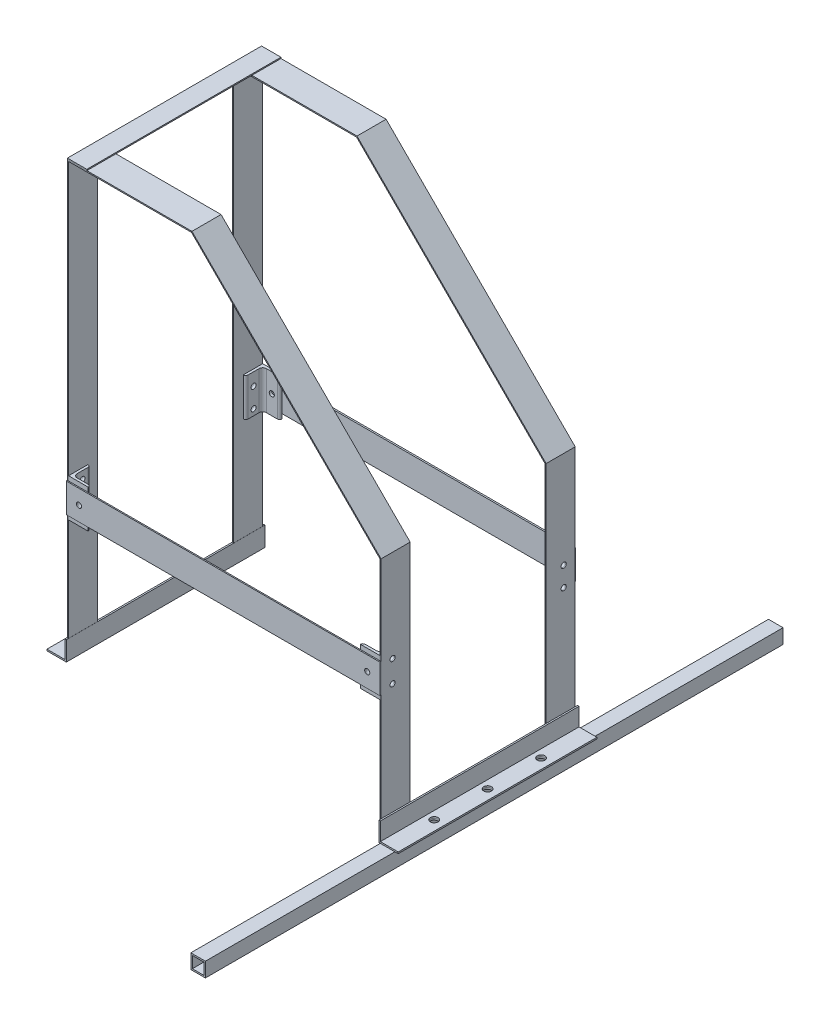
from build123d import *

# Parameters (mm, degrees)
CROQUIS1_W                                  = 19.05
CROQUIS1_H                                  = 19.05
CROQUIS1_W_2                                = 15.05
CROQUIS1_H_2                                = 15.05
SALIENTE_EXTRUIR1_DEPTH                     = 378
SALIENTE_EXTRUIR1_2_DEPTH                   = 378
SALIENTE_EXTRUIR2_DEPTH                     = 130
SALIENTE_EXTRUIR2_2_DEPTH                   = 130
SALIENTE_EXTRUIR3_DEPTH                     = 19.05
MATRIZL1_COUNT                              = 2
MATRIZL1_PITCH                              = 216
CROQUIS5_W                                  = 25.4
CROQUIS5_H                                  = 254.1
SALIENTE_EXTRUIR4_DEPTH                     = 1.5
L_START                                     = 178.739339828
L_ANGLE_L1X1X0_125_1_DEPTH                  = 50
SKETCH12_W                                  = 19.05
SKETCH12_H                                  = 19.05
SKETCH12_W_2                                = 14.8336
SKETCH12_H_2                                = 14.8336
AL_TUBE_SQUARE_0_75_SQ_X_083_WALL_1_DEPTH   = 376.329242488
SKETCH12_ON_SEGMENT_2_W                     = 19.05
SKETCH12_ON_SEGMENT_2_H                     = 19.05
SKETCH12_ON_SEGMENT_2_W_2                   = 14.8336
SKETCH12_ON_SEGMENT_2_H_2                   = 14.8336
AL_TUBE_SQUARE_0_75_SQ_X_083_WALL_1_2_DEPTH = 379.364155734
CROQUIS6_W                                  = 410.487373415
CROQUIS6_H                                  = 38.1
SALIENTE_EXTRUIR5_DEPTH                     = 1.5
CROQUIS14_W                                 = 5.0419
CROQUIS14_H                                 = 21.05
TALADRO_DE_MARGEN_PARA_3_82_AT_2_COUNT      = 2
TALADRO_DE_MARGEN_PARA_3_82_AT_2_PITCH      = 70
TALADRO_DE_MARGEN_PARA_3_82_AT_3_COUNT      = 2
TALADRO_DE_MARGEN_PARA_3_82_AT_3_PITCH      = 140
TALADRO_DE_MARGEN_PARA_3_82_AT_4_COUNT      = 2
TALADRO_DE_MARGEN_PARA_3_82_AT_4_PITCH      = 434.085023559
TALADRO_DE_MARGEN_PARA_3_82_AT_5_COUNT      = 2
TALADRO_DE_MARGEN_PARA_3_82_AT_5_PITCH      = 439.692856069
TALADRO_DE_MARGEN_PARA_3_82_AT_6_COUNT      = 2
TALADRO_DE_MARGEN_PARA_3_82_AT_6_PITCH      = 456.102847698
CROQUIS15_W                                 = 703.878801561
CROQUIS15_H                                 = 245.921773267
CORTAR_EXTRUIR1_DEPTH                       = 757.364155734
CROQUIS16_W                                 = 407.487373415
CROQUIS16_H                                 = 38.1
SALIENTE_EXTRUIR6_DEPTH                     = 2
CROQUIS12_W                                 = 3.3782
CROQUIS12_H                                 = 28.487626585
CROQUIS12_AT_POINT_2_W                      = 3.3782
CROQUIS12_AT_POINT_2_H                      = 28.487626585
CROQUIS12_AT_POINT_3_W                      = 3.3782
CROQUIS12_AT_POINT_3_H                      = 28.487626585
CROQUIS12_AT_POINT_4_W                      = 3.3782
CROQUIS12_AT_POINT_4_H                      = 28.487626585
CROQUIS12_AT_POINT_5_W                      = 3.3782
CROQUIS12_AT_POINT_5_H                      = 28.487626585
CROQUIS12_AT_POINT_6_W                      = 3.3782
CROQUIS12_AT_POINT_6_H                      = 28.487626585
CROQUIS12_AT_POINT_7_W                      = 3.3782
CROQUIS12_AT_POINT_7_H                      = 28.487626585
CROQUIS12_AT_POINT_8_W                      = 3.3782
CROQUIS12_AT_POINT_8_H                      = 28.487626585
CROQUIS12_AT_POINT_9_W                      = 3.3782
CROQUIS12_AT_POINT_9_H                      = 28.487626585
CROQUIS12_AT_POINT_10_W                     = 3.3782
CROQUIS12_AT_POINT_10_H                     = 28.487626585
CROQUIS12_AT_POINT_11_W                     = 3.3782
CROQUIS12_AT_POINT_11_H                     = 28.487626585
CROQUIS12_AT_POINT_12_W                     = 3.3782
CROQUIS12_AT_POINT_12_H                     = 28.487626585


# Read off the part's stored shape, not the designer's step: L angle L1X1X0.125(1)
with BuildPart() as part:
    # Croquis1 → Saliente-Extruir1 (new, symmetric)
    with BuildSketch(Plane.XY):
        with Locations((9.525, 9.525)):
            Rectangle(CROQUIS1_W, CROQUIS1_H)
        with Locations((9.525, 9.525)):
            Rectangle(CROQUIS1_W_2, CROQUIS1_H_2, mode=Mode.SUBTRACT)
    extrude(amount=SALIENTE_EXTRUIR1_DEPTH, both=True)


with BuildPart() as body_2:
    # Croquis1 → Saliente-Extruir1 2 (new, symmetric)
    with BuildSketch(Plane.XY):
        with Locations((224.475, 9.525)):
            Rectangle(CROQUIS1_W, CROQUIS1_H)
        with Locations((224.475, 9.525)):
            Rectangle(CROQUIS1_W_2, CROQUIS1_H_2, mode=Mode.SUBTRACT)
    extrude(amount=SALIENTE_EXTRUIR1_2_DEPTH, both=True)


with BuildPart() as body_3:
    # Croquis2 → Saliente-Extruir2 (new, symmetric)
    with BuildSketch(Plane.XY):
        Polygon((214.95, 44.45), (212.95, 44.45), (212.95, 19.05), (238.35, 19.05), (238.35, 21.05), (214.95, 21.05), align=None)
    extrude(amount=SALIENTE_EXTRUIR2_DEPTH, both=True)


with BuildPart() as body_4:
    # Croquis2 → Saliente-Extruir2 2 (new, symmetric)
    with BuildSketch(Plane.XY):
        Polygon((-197.95, 21.05), (-221.35, 21.05), (-221.35, 19.05), (-195.95, 19.05), (-195.95, 44.45), (-197.95, 44.45), align=None)
    extrude(amount=SALIENTE_EXTRUIR2_2_DEPTH, both=True)


with BuildPart() as body_5:
    # Croquis4 → Saliente-Extruir3 (new, symmetric)
    with BuildSketch(Plane.XY.offset(108)):
        Polygon((212.95, 19.05), (212.95, 339.05), (-34.537373415, 586.537373415), (-197.537373415, 586.537373415), (-197.537373415, 19.05), (-196.037373415, 19.05), (-196.037373415, 585.037373415), (-35.158693759, 585.037373415), (211.45, 338.428679656), (211.45, 19.05), align=None)
    saliente_extruir3 = extrude(amount=SALIENTE_EXTRUIR3_DEPTH, both=True)


with BuildPart() as matrizl1_1:
    # MatrizL1: Saliente-Extruir3 ×2
    with Locations(*[(0, 0, -i * MATRIZL1_PITCH) for i in range(1, MATRIZL1_COUNT)]):
        add(saliente_extruir3)


with BuildPart() as body_7:
    # Croquis5 → Saliente-Extruir4 (new body)
    with BuildSketch(Plane(origin=(0, 586.537373415, 0), x_dir=(1, 0, 0), z_dir=(0, 1, 0))):
        with Locations((-184.837373415, 0)):
            Rectangle(CROQUIS5_W, CROQUIS5_H)
    extrude(amount=SALIENTE_EXTRUIR4_DEPTH)


with BuildPart() as body_8:
    # L angle L1X1X0.125(1) outline → L angle L1X1X0.125(1) (new body)
    with BuildSketch(Plane(origin=(0, 0, 0), x_dir=(1, 0, 0), z_dir=(0, 1, 0)).offset(L_START)):
        with BuildLine():
            Line((186.05, -127.05), (211.45, -127.05))
            Line((211.45, -127.05), (211.45, -101.65))
            Line((211.45, -101.65), (211.44492, -101.65))
            ThreePointArc((211.44492, -101.65), (209.203448072, -102.578448072), (208.275, -104.81992))
            Line((208.275, -104.81992), (208.275, -119.1125))
            ThreePointArc((208.275, -119.1125), (206.880096045, -122.480096045), (203.5125, -123.875))
            Line((203.5125, -123.875), (189.21992, -123.875))
            ThreePointArc((189.21992, -123.875), (186.978448072, -124.803448072), (186.05, -127.04492))
            Line((186.05, -127.04492), (186.05, -127.05))
        make_face()
        with BuildLine():
            Line((-196.037373415, -127.05), (-170.637373415, -127.05))
            Line((-170.637373415, -127.05), (-170.637373415, -127.04492))
            ThreePointArc((-170.637373415, -127.04492), (-171.565821487, -124.803448072), (-173.807293415, -123.875))
            Line((-173.807293415, -123.875), (-188.099873415, -123.875))
            ThreePointArc((-188.099873415, -123.875), (-191.467469461, -122.480096046), (-192.862373415, -119.1125))
            Line((-192.862373415, -119.1125), (-192.862373415, -104.81992))
            ThreePointArc((-192.862373415, -104.81992), (-193.790821487, -102.578448072), (-196.032293415, -101.65))
            Line((-196.032293415, -101.65), (-196.037373415, -101.65))
            Line((-196.037373415, -101.65), (-196.037373415, -127.05))
        make_face()
        with BuildLine():
            Line((186.05, 127.05), (186.05, 127.04492))
            ThreePointArc((186.05, 127.04492), (186.978448072, 124.803448072), (189.21992, 123.875))
            Line((189.21992, 123.875), (203.5125, 123.875))
            ThreePointArc((203.5125, 123.875), (206.880096045, 122.480096045), (208.275, 119.1125))
            Line((208.275, 119.1125), (208.275, 104.81992))
            ThreePointArc((208.275, 104.81992), (209.203448072, 102.578448072), (211.44492, 101.65))
            Line((211.44492, 101.65), (211.45, 101.65))
            Line((211.45, 101.65), (211.45, 127.05))
            Line((211.45, 127.05), (186.05, 127.05))
        make_face()
        with BuildLine():
            Line((-170.637373415, 127.04492), (-170.637373415, 127.05))
            Line((-170.637373415, 127.05), (-196.037373415, 127.05))
            Line((-196.037373415, 127.05), (-196.037373415, 101.65))
            Line((-196.037373415, 101.65), (-196.032293415, 101.65))
            ThreePointArc((-196.032293415, 101.65), (-193.790821487, 102.578448072), (-192.862373415, 104.81992))
            Line((-192.862373415, 104.81992), (-192.862373415, 119.1125))
            ThreePointArc((-192.862373415, 119.1125), (-191.467469461, 122.480096046), (-188.099873415, 123.875))
            Line((-188.099873415, 123.875), (-173.807293415, 123.875))
            ThreePointArc((-173.807293415, 123.875), (-171.565821487, 124.803448072), (-170.637373415, 127.04492))
        make_face()
    extrude(amount=L_ANGLE_L1X1X0_125_1_DEPTH)


with BuildPart() as body_9:
    # Sketch12 → Al tube (square) 0.75 SQ X .083 WALL(1) (new body)
    with BuildSketch(Plane(origin=(-205.475, 9.525, 0), x_dir=(1, 0, 0), z_dir=(0, 0, 1))):
        Rectangle(SKETCH12_W, SKETCH12_H)
        Rectangle(SKETCH12_W_2, SKETCH12_H_2, mode=Mode.SUBTRACT)
    extrude(amount=-AL_TUBE_SQUARE_0_75_SQ_X_083_WALL_1_DEPTH)


with BuildPart() as body_10:
    # Sketch12 on segment 2 (carried to segment 2) → Al tube _square_ 0.75 SQ X .083 WALL_1 2 (new body)
    with BuildSketch(Plane(origin=(-205.475, 9.525, 0), x_dir=(1, 0, 0), z_dir=(0, 0, 1))):
        Rectangle(SKETCH12_ON_SEGMENT_2_W, SKETCH12_ON_SEGMENT_2_H)
        Rectangle(SKETCH12_ON_SEGMENT_2_W_2, SKETCH12_ON_SEGMENT_2_H_2, mode=Mode.SUBTRACT)
    extrude(amount=AL_TUBE_SQUARE_0_75_SQ_X_083_WALL_1_2_DEPTH)


with BuildPart() as body_11:
    # Croquis6 → Saliente-Extruir5 (new body)
    with BuildSketch(Plane.XY.offset(127.05)):
        with Locations((7.706313292, 203.739339828)):
            Rectangle(CROQUIS6_W, CROQUIS6_H)
    extrude(amount=SALIENTE_EXTRUIR5_DEPTH)


with BuildPart() as taladro_de_margen_para_3_82_tool:
    # Croquis14 → Taladro de margen para 3/82 (revolve)
    with BuildSketch(Plane(origin=(225.361255153, 21.05, -70), x_dir=(0, 0, 1), z_dir=(1, 0, 0))):
        with Locations((2.52095, 10.525)):
            Rectangle(CROQUIS14_W, CROQUIS14_H)
    taladro_de_margen_para_3_82 = revolve(axis=Axis((225.361255153, 27.4, -70), (0, -1, 0)))


with BuildPart() as body_2_1:
    add(body_2.part)

    # Taladro de margen para 3/82: cut by taladro_de_margen_para_3_82_tool
    add(taladro_de_margen_para_3_82_tool.part, mode=Mode.SUBTRACT)


with BuildPart() as body_3_1:
    add(body_3.part)

    # Taladro de margen para 3/82: cut by taladro_de_margen_para_3_82_tool
    add(taladro_de_margen_para_3_82_tool.part, mode=Mode.SUBTRACT)


with BuildPart() as taladro_de_margen_para_3_82_at_2_tool:
    # Taladro de margen para 3/82 at 2: Taladro de margen para 3/82 ×2
    with Locations(*[(0, 0, i * TALADRO_DE_MARGEN_PARA_3_82_AT_2_PITCH) for i in range(1, TALADRO_DE_MARGEN_PARA_3_82_AT_2_COUNT)]):
        add(taladro_de_margen_para_3_82)


with BuildPart() as body_2_2:
    add(body_2_1.part)

    # Taladro de margen para 3/82 at 2: cut by taladro_de_margen_para_3_82_at_2_tool
    add(taladro_de_margen_para_3_82_at_2_tool.part, mode=Mode.SUBTRACT)


with BuildPart() as body_3_2:
    add(body_3_1.part)

    # Taladro de margen para 3/82 at 2: cut by taladro_de_margen_para_3_82_at_2_tool
    add(taladro_de_margen_para_3_82_at_2_tool.part, mode=Mode.SUBTRACT)


with BuildPart() as taladro_de_margen_para_3_82_at_3_tool:
    # Taladro de margen para 3/82 at 3: Taladro de margen para 3/82 ×2
    with Locations(*[(0, 0, i * TALADRO_DE_MARGEN_PARA_3_82_AT_3_PITCH) for i in range(1, TALADRO_DE_MARGEN_PARA_3_82_AT_3_COUNT)]):
        add(taladro_de_margen_para_3_82)


with BuildPart() as body_2_3:
    add(body_2_2.part)

    # Taladro de margen para 3/82 at 3: cut by taladro_de_margen_para_3_82_at_3_tool
    add(taladro_de_margen_para_3_82_at_3_tool.part, mode=Mode.SUBTRACT)


with BuildPart() as body_3_3:
    add(body_3_2.part)

    # Taladro de margen para 3/82 at 3: cut by taladro_de_margen_para_3_82_at_3_tool
    add(taladro_de_margen_para_3_82_at_3_tool.part, mode=Mode.SUBTRACT)


with BuildPart() as taladro_de_margen_para_3_82_at_4_tool:
    # Taladro de margen para 3/82 at 4: Taladro de margen para 3/82 ×2
    with Locations(*[(-i * TALADRO_DE_MARGEN_PARA_3_82_AT_4_PITCH, 0, 0) for i in range(1, TALADRO_DE_MARGEN_PARA_3_82_AT_4_COUNT)]):
        add(taladro_de_margen_para_3_82)


with BuildPart() as body_4_1:
    add(body_4.part)

    # Taladro de margen para 3/82 at 4: cut by taladro_de_margen_para_3_82_at_4_tool
    add(taladro_de_margen_para_3_82_at_4_tool.part, mode=Mode.SUBTRACT)


with BuildPart() as body_9_1:
    add(body_9.part)

    # Taladro de margen para 3/82 at 4: cut by taladro_de_margen_para_3_82_at_4_tool
    add(taladro_de_margen_para_3_82_at_4_tool.part, mode=Mode.SUBTRACT)


with BuildPart() as taladro_de_margen_para_3_82_at_5_tool:
    # Taladro de margen para 3/82 at 5: Taladro de margen para 3/82 ×2
    with Locations(*[Vector(-0.9872460231438547, 0, 0.15920204077411657) * (i * TALADRO_DE_MARGEN_PARA_3_82_AT_5_PITCH) for i in range(1, TALADRO_DE_MARGEN_PARA_3_82_AT_5_COUNT)]):
        add(taladro_de_margen_para_3_82)


with BuildPart() as body_4_2:
    add(body_4_1.part)

    # Taladro de margen para 3/82 at 5: cut by taladro_de_margen_para_3_82_at_5_tool
    add(taladro_de_margen_para_3_82_at_5_tool.part, mode=Mode.SUBTRACT)


with BuildPart() as body_9_2:
    add(body_9_1.part)

    # Taladro de margen para 3/82 at 5: cut by taladro_de_margen_para_3_82_at_5_tool
    add(taladro_de_margen_para_3_82_at_5_tool.part, mode=Mode.SUBTRACT)


with BuildPart() as body_10_1:
    add(body_10.part)

    # Taladro de margen para 3/82 at 5: cut by taladro_de_margen_para_3_82_at_5_tool
    add(taladro_de_margen_para_3_82_at_5_tool.part, mode=Mode.SUBTRACT)


with BuildPart() as taladro_de_margen_para_3_82_at_6_tool:
    # Taladro de margen para 3/82 at 6: Taladro de margen para 3/82 ×2
    with Locations(*[Vector(-0.9517261857712123, 0, 0.30694831375555715) * (i * TALADRO_DE_MARGEN_PARA_3_82_AT_6_PITCH) for i in range(1, TALADRO_DE_MARGEN_PARA_3_82_AT_6_COUNT)]):
        add(taladro_de_margen_para_3_82)


with BuildPart() as body_4_3:
    add(body_4_2.part)

    # Taladro de margen para 3/82 at 6: cut by taladro_de_margen_para_3_82_at_6_tool
    add(taladro_de_margen_para_3_82_at_6_tool.part, mode=Mode.SUBTRACT)


with BuildPart() as body_10_2:
    add(body_10_1.part)

    # Taladro de margen para 3/82 at 6: cut by taladro_de_margen_para_3_82_at_6_tool
    add(taladro_de_margen_para_3_82_at_6_tool.part, mode=Mode.SUBTRACT)


with BuildPart() as cortar_extruir1_tool:
    # Croquis15 → Cortar-Extruir1 (new body)
    with BuildSketch(Plane.XY.offset(379.364155734)):
        with Locations((125.532891194, -103.910886633)):
            Rectangle(CROQUIS15_W, CROQUIS15_H)
    extrude(amount=-CORTAR_EXTRUIR1_DEPTH)


with BuildPart() as part_1:
    add(part.part)

    # Cortar-Extruir1: cut by cortar_extruir1_tool
    add(cortar_extruir1_tool.part, mode=Mode.SUBTRACT)


with BuildPart() as body_9_3:
    add(body_9_2.part)

    # Cortar-Extruir1: cut by cortar_extruir1_tool
    add(cortar_extruir1_tool.part, mode=Mode.SUBTRACT)


with BuildPart() as body_10_3:
    add(body_10_2.part)

    # Cortar-Extruir1: cut by cortar_extruir1_tool
    add(cortar_extruir1_tool.part, mode=Mode.SUBTRACT)


with BuildPart() as body_9_2_1:
    # Croquis16 → Saliente-Extruir6 (new body)
    with BuildSketch(Plane(origin=(0, 0, -127.05), x_dir=(-1, 0, 0), z_dir=(0, 0, -1))):
        with Locations((-7.706313292, 203.739339828)):
            Rectangle(CROQUIS16_W, CROQUIS16_H)
    extrude(amount=SALIENTE_EXTRUIR6_DEPTH)


with BuildPart() as taladro_de_margen_para_1_41_tool:
    # Croquis12 → Taladro de margen para 1/41 (revolve)
    with BuildSketch(Plane(origin=(-192.862373415, 218.489748018, 111.96621), x_dir=(0, 0, -1), z_dir=(0, 1, 0))):
        with Locations((1.6891, 14.243813293)):
            Rectangle(CROQUIS12_W, CROQUIS12_H)
    revolve(axis=Axis((-186.512373415, 218.489748018, 111.96621), (-1, 0, 0)))


with BuildPart() as body_5_1:
    add(body_5.part)

    # Taladro de margen para 1/41: cut by taladro_de_margen_para_1_41_tool
    add(taladro_de_margen_para_1_41_tool.part, mode=Mode.SUBTRACT)


with BuildPart() as body_8_1:
    add(body_8.part)

    # Taladro de margen para 1/41: cut by taladro_de_margen_para_1_41_tool
    add(taladro_de_margen_para_1_41_tool.part, mode=Mode.SUBTRACT)


with BuildPart() as taladro_de_margen_para_1_41_at_2_tool:
    # Croquis12 at point 2 (carried to point 2, square into its face) → Taladro de margen para 1/41 at 2 (revolve)
    with BuildSketch(Plane(origin=(-192.862373415, 189.873110431, 111.96621), x_dir=(0, 0, -1), z_dir=(0, 1, 0))):
        with Locations((1.6891, 14.243813293)):
            Rectangle(CROQUIS12_AT_POINT_2_W, CROQUIS12_AT_POINT_2_H)
    revolve(axis=Axis((-186.512373415, 189.873110431, 111.96621), (-1, 0, 0)))


with BuildPart() as body_5_2:
    add(body_5_1.part)

    # Taladro de margen para 1/41 at 2: cut by taladro_de_margen_para_1_41_at_2_tool
    add(taladro_de_margen_para_1_41_at_2_tool.part, mode=Mode.SUBTRACT)


with BuildPart() as body_8_2:
    add(body_8_1.part)

    # Taladro de margen para 1/41 at 2: cut by taladro_de_margen_para_1_41_at_2_tool
    add(taladro_de_margen_para_1_41_at_2_tool.part, mode=Mode.SUBTRACT)


with BuildPart() as taladro_de_margen_para_1_41_at_3_tool:
    # Croquis12 at point 3 (carried to point 3, square into its face) → Taladro de margen para 1/41 at 3 (revolve)
    with BuildSketch(Plane(origin=(-192.862373415, 212.381399498, -111.96621), x_dir=(0, 0, -1), z_dir=(0, 1, 0))):
        with Locations((1.6891, 14.243813293)):
            Rectangle(CROQUIS12_AT_POINT_3_W, CROQUIS12_AT_POINT_3_H)
    revolve(axis=Axis((-186.512373415, 212.381399498, -111.96621), (-1, 0, 0)))


with BuildPart() as matrizl1_1_1:
    add(matrizl1_1.part)

    # Taladro de margen para 1/41 at 3: cut by taladro_de_margen_para_1_41_at_3_tool
    add(taladro_de_margen_para_1_41_at_3_tool.part, mode=Mode.SUBTRACT)


with BuildPart() as body_8_3:
    add(body_8_2.part)

    # Taladro de margen para 1/41 at 3: cut by taladro_de_margen_para_1_41_at_3_tool
    add(taladro_de_margen_para_1_41_at_3_tool.part, mode=Mode.SUBTRACT)


with BuildPart() as taladro_de_margen_para_1_41_at_4_tool:
    # Croquis12 at point 4 (carried to point 4, square into its face) → Taladro de margen para 1/41 at 4 (revolve)
    with BuildSketch(Plane(origin=(-192.862373415, 186.8726845, -111.96621), x_dir=(0, 0, -1), z_dir=(0, 1, 0))):
        with Locations((1.6891, 14.243813293)):
            Rectangle(CROQUIS12_AT_POINT_4_W, CROQUIS12_AT_POINT_4_H)
    revolve(axis=Axis((-186.512373415, 186.8726845, -111.96621), (-1, 0, 0)))


with BuildPart() as matrizl1_1_2:
    add(matrizl1_1_1.part)

    # Taladro de margen para 1/41 at 4: cut by taladro_de_margen_para_1_41_at_4_tool
    add(taladro_de_margen_para_1_41_at_4_tool.part, mode=Mode.SUBTRACT)


with BuildPart() as body_8_4:
    add(body_8_3.part)

    # Taladro de margen para 1/41 at 4: cut by taladro_de_margen_para_1_41_at_4_tool
    add(taladro_de_margen_para_1_41_at_4_tool.part, mode=Mode.SUBTRACT)


with BuildPart() as taladro_de_margen_para_1_41_at_5_tool:
    # Croquis12 at point 5 (carried to point 5, square into its face) → Taladro de margen para 1/41 at 5 (revolve)
    with BuildSketch(Plane(origin=(208.275, 218.489748018, 111.96621), x_dir=(0, 0, -1), z_dir=(0, -1, 0))):
        with Locations((1.6891, 14.243813293)):
            Rectangle(CROQUIS12_AT_POINT_5_W, CROQUIS12_AT_POINT_5_H)
    revolve(axis=Axis((201.925, 218.489748018, 111.96621), (1, 0, 0)))


with BuildPart() as body_5_3:
    add(body_5_2.part)

    # Taladro de margen para 1/41 at 5: cut by taladro_de_margen_para_1_41_at_5_tool
    add(taladro_de_margen_para_1_41_at_5_tool.part, mode=Mode.SUBTRACT)


with BuildPart() as body_8_5:
    add(body_8_4.part)

    # Taladro de margen para 1/41 at 5: cut by taladro_de_margen_para_1_41_at_5_tool
    add(taladro_de_margen_para_1_41_at_5_tool.part, mode=Mode.SUBTRACT)


with BuildPart() as taladro_de_margen_para_1_41_at_6_tool:
    # Croquis12 at point 6 (carried to point 6, square into its face) → Taladro de margen para 1/41 at 6 (revolve)
    with BuildSketch(Plane(origin=(208.275, 189.873110431, 111.96621), x_dir=(0, 0, -1), z_dir=(0, -1, 0))):
        with Locations((1.6891, 14.243813293)):
            Rectangle(CROQUIS12_AT_POINT_6_W, CROQUIS12_AT_POINT_6_H)
    revolve(axis=Axis((201.925, 189.873110431, 111.96621), (1, 0, 0)))


with BuildPart() as body_5_4:
    add(body_5_3.part)

    # Taladro de margen para 1/41 at 6: cut by taladro_de_margen_para_1_41_at_6_tool
    add(taladro_de_margen_para_1_41_at_6_tool.part, mode=Mode.SUBTRACT)


with BuildPart() as body_8_6:
    add(body_8_5.part)

    # Taladro de margen para 1/41 at 6: cut by taladro_de_margen_para_1_41_at_6_tool
    add(taladro_de_margen_para_1_41_at_6_tool.part, mode=Mode.SUBTRACT)


with BuildPart() as taladro_de_margen_para_1_41_at_7_tool:
    # Croquis12 at point 7 (carried to point 7, square into its face) → Taladro de margen para 1/41 at 7 (revolve)
    with BuildSketch(Plane(origin=(208.275, 212.381399498, -111.96621), x_dir=(0, 0, -1), z_dir=(0, -1, 0))):
        with Locations((1.6891, 14.243813293)):
            Rectangle(CROQUIS12_AT_POINT_7_W, CROQUIS12_AT_POINT_7_H)
    revolve(axis=Axis((201.925, 212.381399498, -111.96621), (1, 0, 0)))


with BuildPart() as matrizl1_1_3:
    add(matrizl1_1_2.part)

    # Taladro de margen para 1/41 at 7: cut by taladro_de_margen_para_1_41_at_7_tool
    add(taladro_de_margen_para_1_41_at_7_tool.part, mode=Mode.SUBTRACT)


with BuildPart() as body_8_7:
    add(body_8_6.part)

    # Taladro de margen para 1/41 at 7: cut by taladro_de_margen_para_1_41_at_7_tool
    add(taladro_de_margen_para_1_41_at_7_tool.part, mode=Mode.SUBTRACT)


with BuildPart() as taladro_de_margen_para_1_41_at_8_tool:
    # Croquis12 at point 8 (carried to point 8, square into its face) → Taladro de margen para 1/41 at 8 (revolve)
    with BuildSketch(Plane(origin=(208.275, 186.8726845, -111.96621), x_dir=(0, 0, -1), z_dir=(0, -1, 0))):
        with Locations((1.6891, 14.243813293)):
            Rectangle(CROQUIS12_AT_POINT_8_W, CROQUIS12_AT_POINT_8_H)
    revolve(axis=Axis((201.925, 186.8726845, -111.96621), (1, 0, 0)))


with BuildPart() as matrizl1_1_4:
    add(matrizl1_1_3.part)

    # Taladro de margen para 1/41 at 8: cut by taladro_de_margen_para_1_41_at_8_tool
    add(taladro_de_margen_para_1_41_at_8_tool.part, mode=Mode.SUBTRACT)


with BuildPart() as body_8_8:
    add(body_8_7.part)

    # Taladro de margen para 1/41 at 8: cut by taladro_de_margen_para_1_41_at_8_tool
    add(taladro_de_margen_para_1_41_at_8_tool.part, mode=Mode.SUBTRACT)


with BuildPart() as taladro_de_margen_para_1_41_at_9_tool:
    # Croquis12 at point 9 (carried to point 9, square into its face) → Taladro de margen para 1/41 at 9 (revolve)
    with BuildSketch(Plane(origin=(196.36621, 203.739339828, 123.875), x_dir=(-1, 0, 0), z_dir=(0, 1, 0))):
        with Locations((1.6891, 14.243813293)):
            Rectangle(CROQUIS12_AT_POINT_9_W, CROQUIS12_AT_POINT_9_H)
    revolve(axis=Axis((196.36621, 203.739339828, 117.525), (0, 0, 1)))


with BuildPart() as body_8_9:
    add(body_8_8.part)

    # Taladro de margen para 1/41 at 9: cut by taladro_de_margen_para_1_41_at_9_tool
    add(taladro_de_margen_para_1_41_at_9_tool.part, mode=Mode.SUBTRACT)


with BuildPart() as body_11_1:
    add(body_11.part)

    # Taladro de margen para 1/41 at 9: cut by taladro_de_margen_para_1_41_at_9_tool
    add(taladro_de_margen_para_1_41_at_9_tool.part, mode=Mode.SUBTRACT)


with BuildPart() as taladro_de_margen_para_1_41_at_10_tool:
    # Croquis12 at point 10 (carried to point 10, square into its face) → Taladro de margen para 1/41 at 10 (revolve)
    with BuildSketch(Plane(origin=(-180.953583415, 203.739339828, 123.875), x_dir=(-1, 0, 0), z_dir=(0, 1, 0))):
        with Locations((1.6891, 14.243813293)):
            Rectangle(CROQUIS12_AT_POINT_10_W, CROQUIS12_AT_POINT_10_H)
    revolve(axis=Axis((-180.953583415, 203.739339828, 117.525), (0, 0, 1)))


with BuildPart() as body_8_10:
    add(body_8_9.part)

    # Taladro de margen para 1/41 at 10: cut by taladro_de_margen_para_1_41_at_10_tool
    add(taladro_de_margen_para_1_41_at_10_tool.part, mode=Mode.SUBTRACT)

    # Croquis12 at point 11 (carried to point 11, square into its face) → Taladro de margen para 1/41 at 11 (revolve, cut)
    with BuildSketch(Plane(origin=(-180.953583415, 203.739339828, -123.875), x_dir=(1, 0, 0), z_dir=(0, 1, 0))):
        with Locations((1.6891, 14.243813293)):
            Rectangle(CROQUIS12_AT_POINT_11_W, CROQUIS12_AT_POINT_11_H)
    revolve(axis=Axis((-180.953583415, 203.739339828, -117.525), (0, 0, -1)), mode=Mode.SUBTRACT)

    # Croquis12 at point 12 (carried to point 12, square into its face) → Taladro de margen para 1/41 at 12 (revolve, cut)
    with BuildSketch(Plane(origin=(196.36621, 203.739339828, -123.875), x_dir=(1, 0, 0), z_dir=(0, 1, 0))):
        with Locations((1.6891, 14.243813293)):
            Rectangle(CROQUIS12_AT_POINT_12_W, CROQUIS12_AT_POINT_12_H)
    revolve(axis=Axis((196.36621, 203.739339828, -117.525), (0, 0, -1)), mode=Mode.SUBTRACT)


with BuildPart() as body_11_2:
    add(body_11_1.part)

    # Taladro de margen para 1/41 at 10: cut by taladro_de_margen_para_1_41_at_10_tool
    add(taladro_de_margen_para_1_41_at_10_tool.part, mode=Mode.SUBTRACT)


solid = Compound([body_7.part, body_2_3.part, body_3_3.part, body_4_3.part, body_9_2_1.part, body_5_4.part, matrizl1_1_4.part, body_8_10.part, body_11_2.part])
